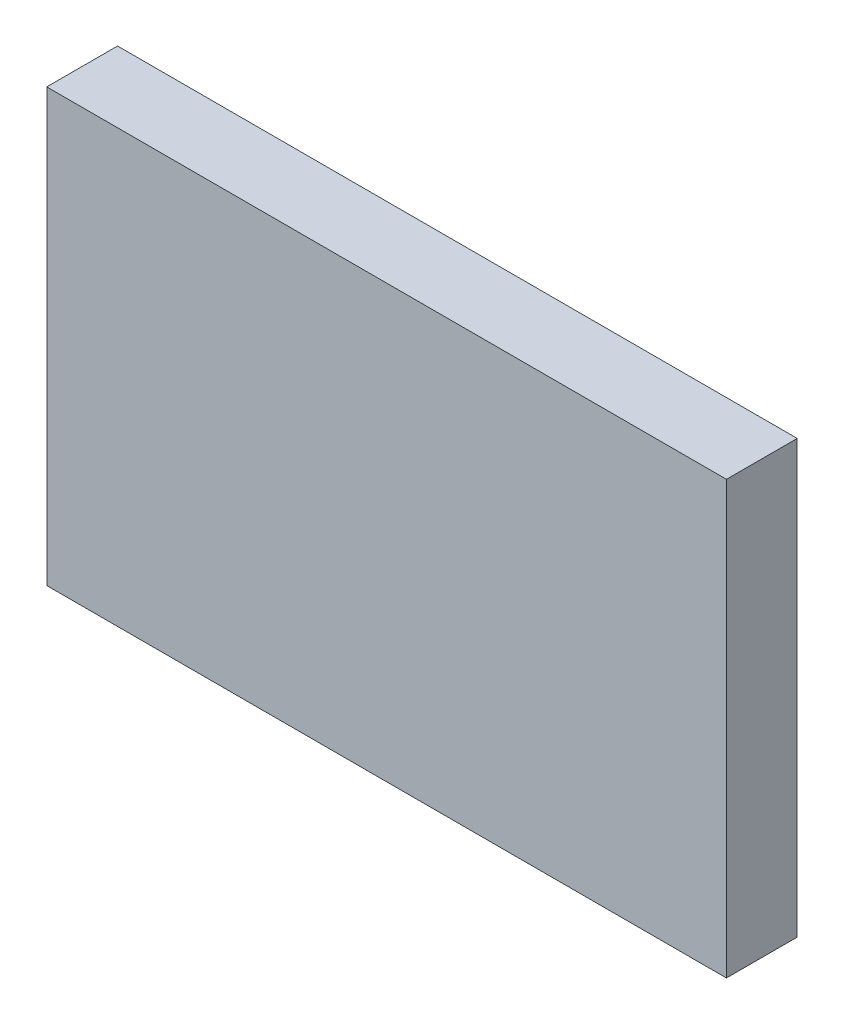
from build123d import *

# Parameters (mm, degrees)
IZIM1_W                    = 595
IZIM1_H                    = 194
TABAN_FLAN_1_DEPTH         = 30
KES_EKSTR_ZYON1_DEPTH      = 627.546885716
KES_EKSTR_ZYON1_DEPTH_BACK = 627.546885716
IZIM2_W                    = 307
IZIM2_H                    = 194
KES_EKSTR_ZYON2_DEPTH      = 349.539811212
KES_EKSTR_ZYON2_DEPTH_BACK = 349.539811212
IZIM3_W                    = 288
IZIM3_H                    = 11


# Sheet-metal steps are written as plain solids
with BuildPart() as part:
    # Çizim1 → Taban-Flanş1 (new body)
    with BuildSketch(Plane.XY):
        with Locations((297.5, -97)):
            Rectangle(IZIM1_W, IZIM1_H)
    extrude(amount=-TABAN_FLAN_1_DEPTH)

    # Çizim2 → Kes-Ekstrüzyon1 (cut, two sides: drawn at the far end of the back side and taken through both)
    with BuildSketch(Plane.XY.offset(-KES_EKSTR_ZYON1_DEPTH_BACK)):
        with Locations((441.5, -97)):
            Rectangle(IZIM2_W, IZIM2_H)
    extrude(amount=KES_EKSTR_ZYON1_DEPTH + KES_EKSTR_ZYON1_DEPTH_BACK, mode=Mode.SUBTRACT)

    # Çizim3 → Kes-Ekstrüzyon2 (cut, two sides: drawn at the far end of the back side and taken through both)
    with BuildSketch(Plane.XY.offset(-KES_EKSTR_ZYON2_DEPTH_BACK)):
        with Locations((144, -5.5)):
            Rectangle(IZIM3_W, IZIM3_H)
    extrude(amount=KES_EKSTR_ZYON2_DEPTH + KES_EKSTR_ZYON2_DEPTH_BACK, mode=Mode.SUBTRACT)


solid = part.part
